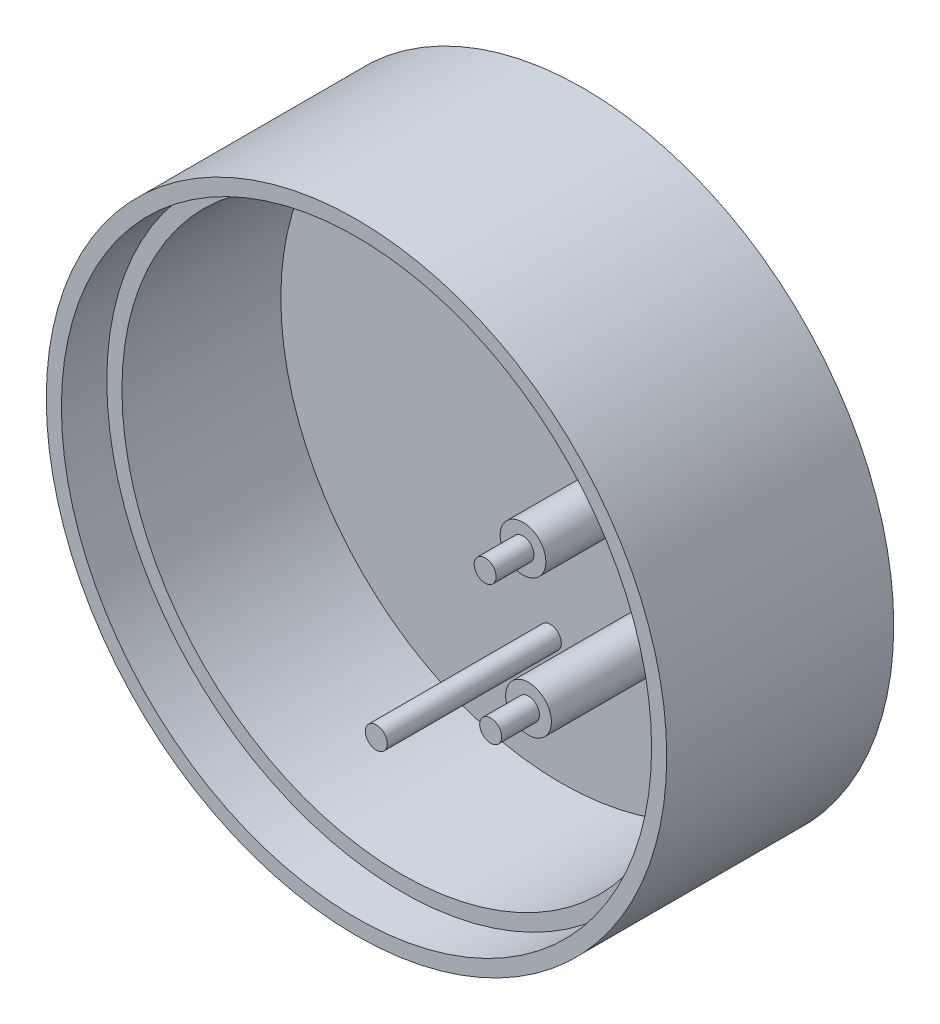
from build123d import *

# Parameters (mm, degrees)
SKETCH_1_R      = 41
SKETCH_1_R_2    = 39
EXTRUDE_1_DEPTH = 30
SKETCH_2_R      = 39
SKETCH_2_R_2    = 37
EXTRUDE_2_DEPTH = 24
SKETCH_3D_1_R   = 39
EXTRUDE_3_DEPTH = 3
SKETCH_5_R      = 1.45
EXTRUDE_4_DEPTH = 23
SKETCH_6_R      = 1.45
EXTRUDE_5_DEPTH = 25
SKETCH_7_R      = 3.022472912
EXTRUDE_6_DEPTH = 20
SKETCH_8_R      = 1.45
EXTRUDE_7_DEPTH = 27
SKETCH_9_R      = 3.022472912
EXTRUDE_8_DEPTH = 22


with BuildPart() as part:
    # 草图1 → 凸台-拉伸1 (new body)
    with BuildSketch(Plane.XY):
        Circle(SKETCH_1_R)
        Circle(SKETCH_1_R_2, mode=Mode.SUBTRACT)
    extrude(amount=EXTRUDE_1_DEPTH)

    # 草图2 → 凸台-拉伸2 (add)
    with BuildSketch(Plane.XY):
        Circle(SKETCH_2_R)
        Circle(SKETCH_2_R_2, mode=Mode.SUBTRACT)
    extrude(amount=EXTRUDE_2_DEPTH)

    # Sketch 3D_1 → 凸台-拉伸3 (add)
    with BuildSketch(Plane(origin=(0, 0, 0), x_dir=(-1, 0, 0), z_dir=(0, 0, -1))):
        Circle(SKETCH_3D_1_R)
    extrude(amount=-EXTRUDE_3_DEPTH)

    # 草图5 → 凸台-拉伸4 (add)
    with BuildSketch(Plane.XY.offset(3)):
        with Locations((-1.382493562, -21)):
            Circle(SKETCH_5_R)
    extrude(amount=EXTRUDE_4_DEPTH)

    # 草图6 → 凸台-拉伸5 (add)
    with BuildSketch(Plane.XY.offset(3)):
        with Locations((15.732786494, -10.652672394)):
            Circle(SKETCH_6_R)
    extrude(amount=EXTRUDE_5_DEPTH)

    # 草图7 → 凸台-拉伸6 (add)
    with BuildSketch(Plane.XY.offset(3)):
        with Locations((15.732786494, -10.652672394)):
            Circle(SKETCH_7_R)
    extrude(amount=EXTRUDE_6_DEPTH)

    # 草图8 → 凸台-拉伸7 (add)
    with BuildSketch(Plane.XY.offset(3)):
        with Locations((17, 9.307141481)):
            Circle(SKETCH_8_R)
    extrude(amount=EXTRUDE_7_DEPTH)

    # 草图9 → 凸台-拉伸8 (add)
    with BuildSketch(Plane.XY.offset(3)):
        with Locations((17, 9.307141481)):
            Circle(SKETCH_9_R)
    extrude(amount=EXTRUDE_8_DEPTH)


solid = part.part
